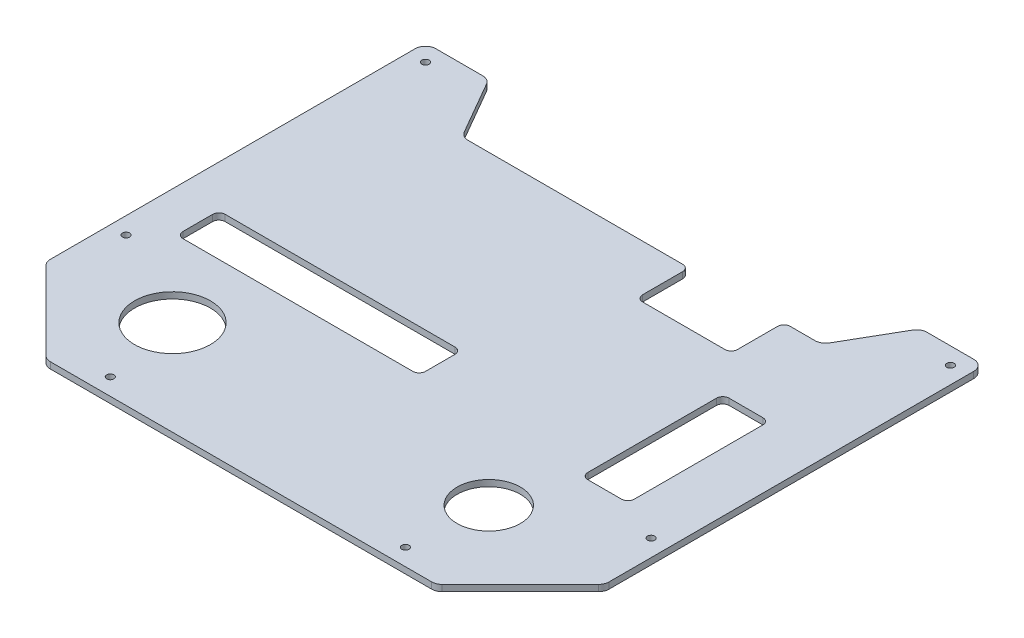
from build123d import *

# Parameters (mm, degrees)
BOSS_EXTRU_1_DEPTH      = 3
CONG_1_R                = 5
ESQUISSE2_R             = 1
ENL_V_MAT_EXTRU_1_DEPTH = 257.837010573
D_GAGEMENT_M31_D        = 3.4
ESQUISSE5_R             = 18
ESQUISSE5_R_2           = 15
ESQUISSE5_W             = 45
ESQUISSE5_H             = 25
ESQUISSE5_W_2           = 115
ESQUISSE5_H_2           = 20
ESQUISSE5_W_3           = 22
ESQUISSE5_H_3           = 67
ENL_V_MAT_EXTRU_2_DEPTH = 257.837010573
CONG_2_R                = 3


with BuildPart() as part:
    # Esquisse1 → Boss.-Extru.1 (new body)
    with BuildSketch(Plane(origin=(0, 0, 0), x_dir=(1, 0, 0), z_dir=(0, 1, 0))):
        Polygon((-92.5, 0), (92.5, 0), (132.5, 40), (132.5, 220), (102.5, 220), (85.179491924, 190), (-85.179491924, 190), (-102.5, 220), (-132.5, 220), (-132.5, 40), align=None)
    extrude(amount=BOSS_EXTRU_1_DEPTH)

    # Congé1
    cong_1_edges = [part.edges().sort_by_distance(p)[0] for p in [
        (132.5, 1.5, -220),
        (102.5, 1.5, -220),
        (85.179491924, 1.5, -190),
        (-85.179491924, 1.5, -190),
        (-102.5, 1.5, -220),
        (-132.5, 1.5, -220),
        (-132.5, 1.5, -40),
        (-92.5, 1.5, 0),
        (92.5, 1.5, 0),
        (132.5, 1.5, -40),
    ]]
    fillet(cong_1_edges, radius=CONG_1_R)

    # Esquisse2 → Enlèv. mat.-Extru.1 (cut, through all)
    with BuildSketch(Plane.XZ):
        with Locations((-70, -8)):
            Circle(ESQUISSE2_R)
        with Locations((-124.5, -70)):
            Circle(ESQUISSE2_R)
        with Locations((-124.5, -212)):
            Circle(ESQUISSE2_R)
        with Locations((124.5, -212)):
            Circle(ESQUISSE2_R)
        with Locations((124.5, -70)):
            Circle(ESQUISSE2_R)
        with Locations((70, -8)):
            Circle(ESQUISSE2_R)
    extrude(amount=-ENL_V_MAT_EXTRU_1_DEPTH, mode=Mode.SUBTRACT)

    # Dégagement M31 (through all)
    with Locations(Plane(origin=(0, 0, 0), x_dir=(-1, 0, 0), z_dir=(0, -1, 0))):
        with Locations((-70, 8), (-124.5, 70), (-124.5, 212), (124.5, 212), (124.5, 70), (70, 8)):
            Hole(D_GAGEMENT_M31_D / 2)

    # Esquisse5 → Enlèv. mat.-Extru.2 (cut, through all)
    with BuildSketch(Plane.XZ):
        with Locations((-77.5, -45)):
            Circle(ESQUISSE5_R)
        with Locations((72.5, -45)):
            Circle(ESQUISSE5_R_2)
        with Locations((45, -177.5)):
            Rectangle(ESQUISSE5_W, ESQUISSE5_H)
        with Locations((-55, -92)):
            Rectangle(ESQUISSE5_W_2, ESQUISSE5_H_2)
        with Locations((93.5, -112.5)):
            Rectangle(ESQUISSE5_W_3, ESQUISSE5_H_3)
    extrude(amount=-ENL_V_MAT_EXTRU_2_DEPTH, mode=Mode.SUBTRACT)

    # Congé2
    cong_2_edges = [part.edges().sort_by_distance(p)[0] for p in [
        (67.5, 1.5, -190),
        (67.5, 1.5, -165),
        (22.5, 1.5, -165),
        (22.5, 1.5, -190),
        (104.5, 1.5, -146),
        (82.5, 1.5, -146),
        (82.5, 1.5, -79),
        (104.5, 1.5, -79),
        (2.5, 1.5, -82),
        (2.5, 1.5, -102),
        (-112.5, 1.5, -82),
        (-112.5, 1.5, -102),
    ]]
    fillet(cong_2_edges, radius=CONG_2_R)


solid = part.part
